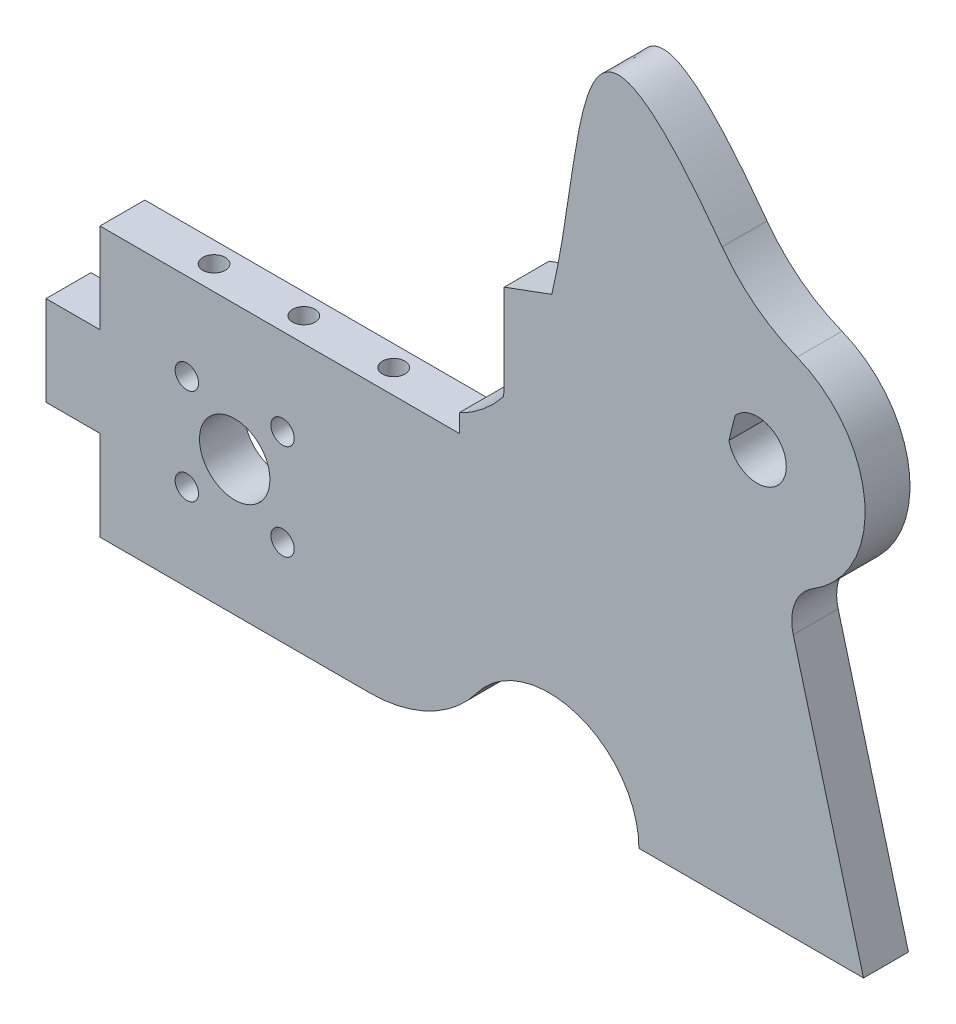
from build123d import *

# Parameters (mm, degrees)
SKETCH1_R           = 4.09575
SKETCH1_R_2         = 1.651
BOSS_EXTRUDE1_DEPTH = 6.35
SKETCH3_R           = 1.5875
CUT_EXTRUDE1_DEPTH  = 6.35
CUT_EXTRUDE2_DEPTH  = 6.35
SKETCH7_R           = 4.9784
CUT_EXTRUDE3_DEPTH  = 131.317526076
FILLET1_R           = 6.35
SKETCH8_W           = 50.8
SKETCH8_H           = 38.1
CUT_EXTRUDE4_DEPTH  = 50.8
CUT_EXTRUDE5_DEPTH  = 19.304
FILLET6_R           = 6.35
FILLET8_R           = 19.05
SKETCH10_R          = 1.5875
CUT_EXTRUDE6_DEPTH  = 6.35
SKETCH11_R          = 1.5875
CUT_EXTRUDE7_DEPTH  = 6.35
BOSS_EXTRUDE2_DEPTH = 6.35
FILLET9_R           = 24.13


with BuildPart() as part:
    # Sketch1 → Boss-Extrude1 (new body)
    with BuildSketch(Plane.XY):
        with BuildLine():
            Line((0, 0), (107.95, 0))
            Line((107.95, 0), (100.9362606, 26.175631792))
            Line((100.9362606, 26.175631792), (96.600438298, 42.357140917))
            ThreePointArc((96.600438298, 42.357140917), (108.063690957, 58.995863967), (92.935889192, 72.39))
            Line((92.935889192, 72.39), (0, 38.1))
            Line((0, 38.1), (0, 25.4))
            Line((0, 25.4), (-7.62, 25.4))
            Line((-7.62, 25.4), (-7.62, 12.7))
            Line((-7.62, 12.7), (0, 12.7))
            Line((0, 12.7), (0, 0))
        make_face()
        with Locations((92.935889192, 57.15)):
            Circle(SKETCH1_R, mode=Mode.SUBTRACT)
        with Locations((25.817011896, 25.817011896)):
            Circle(SKETCH1_R_2, mode=Mode.SUBTRACT)
        with Locations((25.817011896, 12.282988104)):
            Circle(SKETCH1_R_2, mode=Mode.SUBTRACT)
        with Locations((12.282988104, 12.282988104)):
            Circle(SKETCH1_R_2, mode=Mode.SUBTRACT)
        with Locations((12.282988104, 25.817011896)):
            Circle(SKETCH1_R_2, mode=Mode.SUBTRACT)
    extrude(amount=BOSS_EXTRUDE1_DEPTH)

    # Sketch3 → Cut-Extrude1 (cut)
    with BuildSketch(Plane.ZY):
        with Locations(Location((3.175, 31.75, 0), (0, 0, 270))):
            Circle(SKETCH3_R)
        with Locations(Location((3.175, 6.35, 0), (0, 0, 270))):
            Circle(SKETCH3_R)
    extrude(amount=-CUT_EXTRUDE1_DEPTH, mode=Mode.SUBTRACT)

    # Sketch6 → Cut-Extrude2 (cut)
    with BuildSketch(Plane.XY.offset(6.35)):
        with BuildLine():
            Line((50.8, 0), (76.2, 0))
            ThreePointArc((76.2, 0), (63.5, 12.7), (50.8, 0))
        make_face()
    extrude(amount=-CUT_EXTRUDE2_DEPTH, mode=Mode.SUBTRACT)

    # Sketch7 → Cut-Extrude3 (cut, through all)
    with BuildSketch(Plane.XY.offset(6.35)):
        with Locations((19.05, 19.05)):
            Circle(SKETCH7_R)
    extrude(amount=-CUT_EXTRUDE3_DEPTH, mode=Mode.SUBTRACT)

    # Fillet1
    fillet1_edges = [part.edges().sort_by_distance(p)[0] for p in [
        (96.600438298, 42.357140917, 3.175),
    ]]
    fillet(fillet1_edges, radius=FILLET1_R)

    # Sketch8 → Cut-Extrude4 (cut)
    with BuildSketch(Plane.XY.offset(6.35)):
        with Locations((25.4, 57.15)):
            Rectangle(SKETCH8_W, SKETCH8_H)
    extrude(amount=-CUT_EXTRUDE4_DEPTH, mode=Mode.SUBTRACT)

    # Sketch9 → Cut-Extrude5 (cut)
    with BuildSketch(Plane.XY.offset(6.35)):
        Polygon((50.8, 56.84337261), (50.8, 40.64), (57.15, 40.64), (57.15, 59.186294187), align=None)
    extrude(amount=-CUT_EXTRUDE5_DEPTH, mode=Mode.SUBTRACT)

    # Fillet6
    fillet6_edges = [part.edges().sort_by_distance(p)[0] for p in [
        (57.15, 40.64, 3.175),
    ]]
    fillet(fillet6_edges, radius=FILLET6_R - 0.0001)  # a hair under: the kernel refuses the full size

    # Fillet8
    fillet8_edges = [part.edges().sort_by_distance(p)[0] for p in [
        (50.8, 0, 3.175),
    ]]
    fillet(fillet8_edges, radius=FILLET8_R)

    # Sketch10 → Cut-Extrude6 (cut)
    with BuildSketch(Plane.XZ):
        with Locations(Location((97.79, 3.175, 0), (0, 0, 270))):
            Circle(SKETCH10_R)
        with Locations(Location((86.36, 3.175, 0), (0, 0, 270))):
            Circle(SKETCH10_R)
        with Locations(Location((31.75, 3.175, 0), (0, 0, 270))):
            Circle(SKETCH10_R)
        with Locations(Location((12.7, 3.175, 0), (0, 0, 270))):
            Circle(SKETCH10_R)
    extrude(amount=-CUT_EXTRUDE6_DEPTH, mode=Mode.SUBTRACT)

    # Sketch11 → Cut-Extrude7 (cut)
    with BuildSketch(Plane(origin=(0, 38.1, 0), x_dir=(1, 0, 0), z_dir=(0, 1, 0))):
        with Locations(Location((12.7, -2.922371253, 0), (0, 0, 270))):
            Circle(SKETCH11_R)
        with Locations(Location((25.4, -2.922371253, 0), (0, 0, 270))):
            Circle(SKETCH11_R)
        with Locations(Location((38.1, -2.922371253, 0), (0, 0, 270))):
            Circle(SKETCH11_R)
    extrude(amount=-CUT_EXTRUDE7_DEPTH, mode=Mode.SUBTRACT)

    # Sketch12 → Boss-Extrude2 (add)
    with BuildSketch(Plane.XY.offset(6.35)):
        with BuildLine():
            Line((50.8, 40.64), (85.027112904, 40.64))
            Line((85.027112904, 40.64), (92.935889192, 72.39))
            add(Edge.make_bspline(
                [(50.8, 40.64), (77.240642826, 53.266729026), (54.818289847, 129.190596971), (92.935889192, 72.39)],
                knots=[0, 0, 0, 0, 1, 1, 1, 1], degree=3))
        make_face()
    extrude(amount=-BOSS_EXTRUDE2_DEPTH)

    # Fillet9
    fillet9_edges = [part.edges().sort_by_distance(p)[0] for p in [
        (92.935889192, 72.39, 3.175),
    ]]
    fillet(fillet9_edges, radius=FILLET9_R)


solid = part.part
